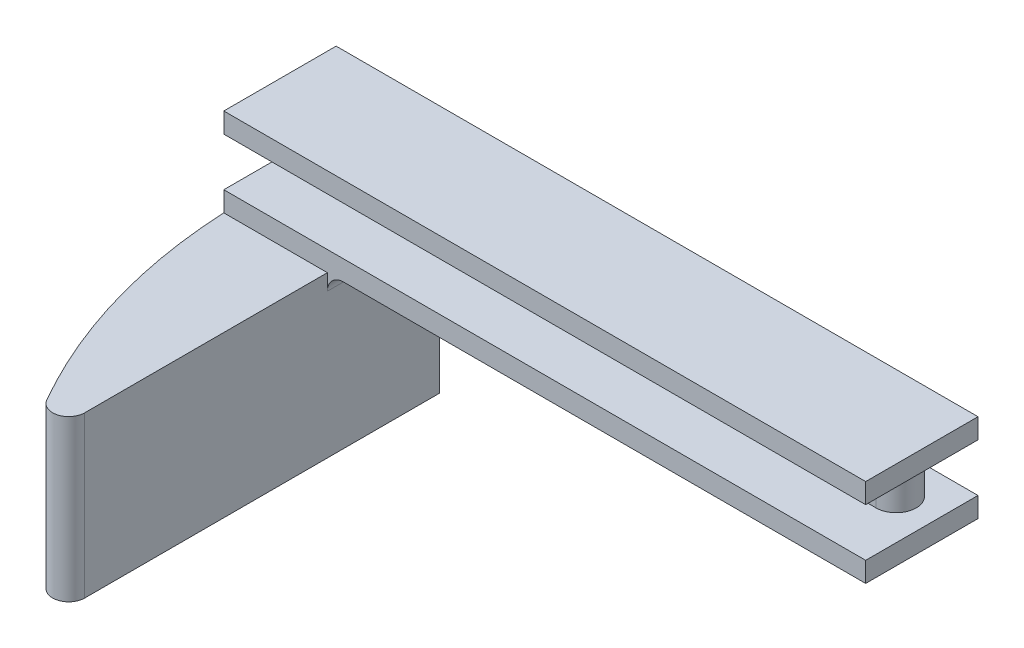
from build123d import *

# Parameters (mm, degrees)
SKETCH2_W           = 101.6
SKETCH2_H           = 17.78
BOSS_EXTRUDE1_DEPTH = 3.175
BOSS_EXTRUDE2_DEPTH = 7.62
BOSS_EXTRUDE3_DEPTH = 25.4
FILLET1_R           = 2.54
FILLET2_R           = 2.54


with BuildPart() as part:
    # Sketch2 → Boss-Extrude1 (new body)
    with BuildSketch(Plane(origin=(0, 0, 0), x_dir=(1, 0, 0), z_dir=(0, 1, 0))):
        with Locations((50.8, 8.89)):
            Rectangle(SKETCH2_W, SKETCH2_H)
    boss_extrude1 = extrude(amount=BOSS_EXTRUDE1_DEPTH)

    # Sketch3 → Boss-Extrude2 (add)
    with BuildSketch(Plane.XZ):
        with BuildLine():
            Line((95.25, -14.351), (6.35, -14.351))
            ThreePointArc((6.35, -14.351), (3.175, -11.176), (6.35, -8.001))
            Line((6.35, -8.001), (95.25, -8.001))
            ThreePointArc((95.25, -8.001), (98.425, -11.176), (95.25, -14.351))
        make_face()
    extrude(amount=BOSS_EXTRUDE2_DEPTH)

    # Mirror1: Boss-Extrude1 across plane
    add(boss_extrude1.mirror(Plane(origin=(0, -3.81, 0), x_dir=(0, 0, 1), z_dir=(0, -1, 0))))

    # Sketch4 → Boss-Extrude3 (add)
    with BuildSketch(Plane.XZ.offset(10.795)):
        with BuildLine():
            Line((0, -17.78), (16.393849753, -17.78))
            Line((16.393849753, -17.78), (16.393849753, 0))
            Line((16.393849753, 0), (16.393849753, 47.008966697))
            ThreePointArc((16.393849753, 47.008966697), (4.7870119, 24.693652244), (0, 0))
            Line((0, 0), (0, -17.78))
        make_face()
    extrude(amount=BOSS_EXTRUDE3_DEPTH)

    # Fillet1
    fillet1_edges = [part.edges().sort_by_distance(p)[0] for p in [
        (16.393849753, -10.795, -8.89),
    ]]
    fillet(fillet1_edges, radius=FILLET1_R)

    # Fillet2
    fillet2_edges = [part.edges().sort_by_distance(p)[0] for p in [
        (16.393849753, -23.495, 47.008966697),
    ]]
    fillet(fillet2_edges, radius=FILLET2_R)


solid = part.part
